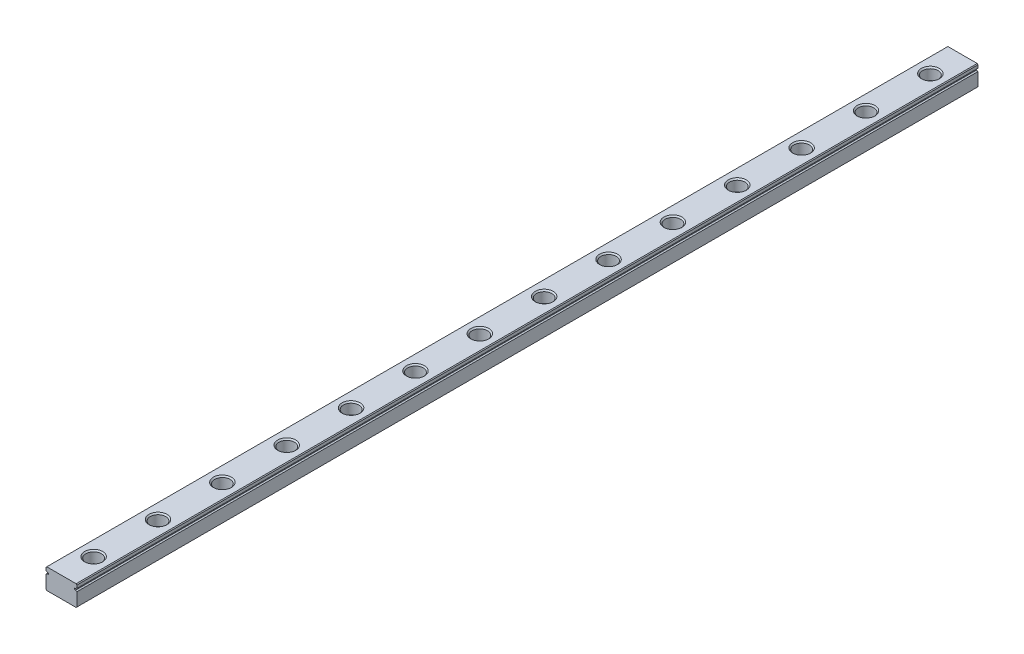
from build123d import *

# Parameters (mm, degrees)
BOSS_EXTRUDE1_DEPTH = 350
CHAMFER1_SIZE       = 0.3
LPATTERN1_COUNT     = 14
LPATTERN1_PITCH     = 25


with BuildPart() as part:
    # Sketch1 → Boss-Extrude1 (new body)
    with BuildSketch(Plane.XY):
        with BuildLine():
            Line((-6, 4), (6, 4))
            Line((6, 4), (6, 2.75))
            Line((6, 2.75), (6, 2.559016994))
            ThreePointArc((6, 2.559016994), (5.706107374, 2.475528258), (5.5, 2.25))
            Line((5.5, 2.25), (5, 2.25))
            Line((5, 2.25), (5, 1.75))
            Line((5, 1.75), (5.5, 1.75))
            ThreePointArc((5.5, 1.75), (5.706107374, 1.524471742), (6, 1.440983006))
            Line((6, 1.440983006), (6, 1.25))
            Line((6, 1.25), (6, -4))
            Line((6, -4), (-6, -4))
            Line((-6, -4), (-6, 1.25))
            Line((-6, 1.25), (-6, 1.440983006))
            ThreePointArc((-6, 1.440983006), (-5.706107374, 1.524471742), (-5.5, 1.75))
            Line((-5.5, 1.75), (-5, 1.75))
            Line((-5, 1.75), (-5, 2.25))
            Line((-5, 2.25), (-5.5, 2.25))
            ThreePointArc((-5.5, 2.25), (-5.706107374, 2.475528258), (-6, 2.559016994))
            Line((-6, 2.559016994), (-6, 2.75))
            Line((-6, 2.75), (-6, 4))
        make_face()
    extrude(amount=BOSS_EXTRUDE1_DEPTH)

    # Chamfer1
    chamfer1_edges = [part.edges().sort_by_distance(p)[0] for p in [
        (-6, -4, 175),
        (6, -4, 175),
        (-6, 4, 175),
        (6, 4, 175),
    ]]
    chamfer(chamfer1_edges, length=CHAMFER1_SIZE)

    # Sketch3 → M3 六角承窩頭蓋螺釘的柱孔1 (revolve, cut)
    with BuildSketch(Plane(origin=(0, 4, 12.5), x_dir=(0, 0, 1), z_dir=(1, 0, 0))):
        Polygon((0, 0), (0, 8), (2, 8), (1.75, 7.75), (1.75, 4.5), (3, 4.5), (3, 0.5), (3.5, 0), align=None)
    hole_wizard_m3_1 = revolve(axis=Axis((0, 10.35, 12.5), (0, -1, 0)), mode=Mode.SUBTRACT)

    # LPattern1: M3 六角承窩頭蓋螺釘的柱孔1 ×14
    with Locations(*[(0, 0, i * LPATTERN1_PITCH) for i in range(1, LPATTERN1_COUNT)]):
        add(hole_wizard_m3_1, mode=Mode.SUBTRACT)


solid = part.part
